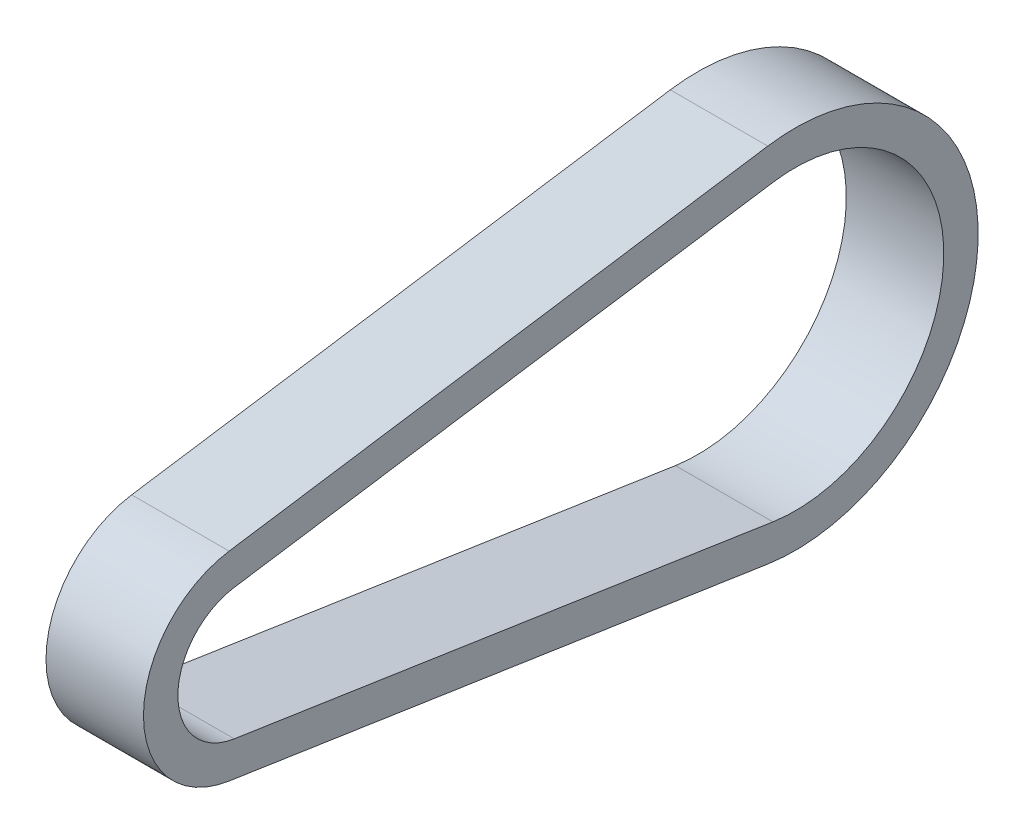
from build123d import *

# Parameters (mm, degrees)
BOSS_EXTRUDE1_DEPTH = 4.5


with BuildPart() as part:
    # Sketch1 → Boss-Extrude1 (new, symmetric)
    with BuildSketch(Plane(origin=(0, 0, 0), x_dir=(0, 0, -1), z_dir=(1, 0, 0))):
        with BuildLine():
            Line((-1.389966368, 9.194470002), (48.349506151, 16.713793462))
            ThreePointArc((48.349506151, 16.713793462), (67.7799, 0), (48.349506151, -16.713793462))
            Line((48.349506151, -16.713793462), (-1.389966368, -9.194470002))
            ThreePointArc((-1.389966368, -9.194470002), (-9.29894, 0), (-1.389966368, 9.194470002))
        make_face()
        with BuildLine():
            Line((-0.915380747, 6.0551399), (48.824091772, 13.57446336))
            ThreePointArc((48.824091772, 13.57446336), (64.6049, 0), (48.824091772, -13.57446336))
            Line((48.824091772, -13.57446336), (-0.915380747, -6.0551399))
            ThreePointArc((-0.915380747, -6.0551399), (-6.12394, 0), (-0.915380747, 6.0551399))
        make_face(mode=Mode.SUBTRACT)
    extrude(amount=BOSS_EXTRUDE1_DEPTH, both=True)


solid = part.part
